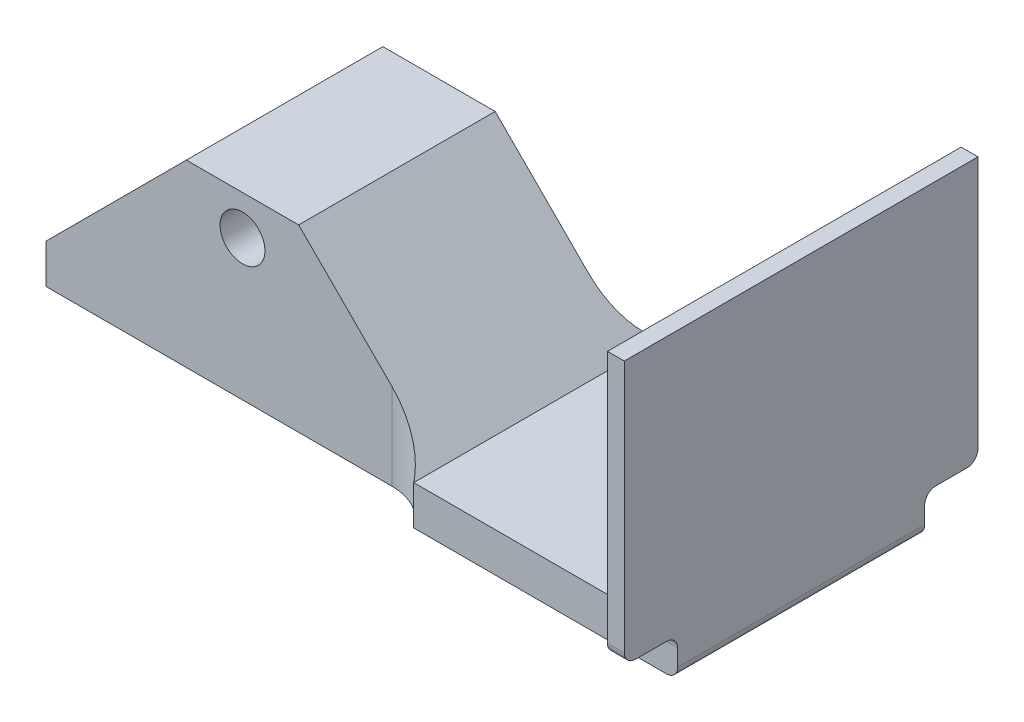
from build123d import *

# Parameters (mm, degrees)
SKETCH1_W           = 70
SKETCH1_H           = 35
BOSS_EXTRUDE1_DEPTH = 32
SKETCH2_R           = 4
CUT_EXTRUDE1_DEPTH  = 59.940648113
CHAMFER1_SIZE       = 25
SKETCH3_W           = 44
SKETCH3_H           = 7
BOSS_EXTRUDE2_DEPTH = 47
FILLET1_R           = 10
FILLET2_R           = 10
SKETCH4_W           = 3
SKETCH4_H           = 63
BOSS_EXTRUDE3_DEPTH = 47
FILLET3_R           = 2


with BuildPart() as part:
    # Sketch1 → Boss-Extrude1 (new body)
    with BuildSketch(Plane(origin=(0, 0, 0), x_dir=(1, 0, 0), z_dir=(0, 1, 0))):
        Rectangle(SKETCH1_W, SKETCH1_H)
    extrude(amount=BOSS_EXTRUDE1_DEPTH)

    # Sketch2 → Cut-Extrude1 (cut, through all)
    with BuildSketch(Plane.XY.offset(17.5)):
        with Locations((0, 25)):
            Circle(SKETCH2_R)
    extrude(amount=-CUT_EXTRUDE1_DEPTH, mode=Mode.SUBTRACT)

    # Chamfer1
    chamfer1_edges = [part.edges().sort_by_distance(p)[0] for p in [
        (-35, 32, 0),
        (35, 32, 0),
    ]]
    chamfer(chamfer1_edges, length=CHAMFER1_SIZE)

    # Sketch3 → Boss-Extrude2 (add)
    with BuildSketch(Plane(origin=(35, 0, 0), x_dir=(0, 0, -1), z_dir=(1, 0, 0))):
        with Locations((0, 3.5)):
            Rectangle(SKETCH3_W, SKETCH3_H)
    extrude(amount=BOSS_EXTRUDE2_DEPTH)

    # Fillet1
    # the kernel refuses this fillet: 10 mm, written as the material it adds along each edge
    with BuildSketch(Plane(origin=(35, 0, -17.5), x_dir=(-1.5347723092402642e-12, 0, -1.0), z_dir=(0, 1, 0))) as fillet1_piece_1_section:
        with BuildLine():
            CenterArc((10, 8.351646544), FILLET1_R, 180, 56.632987031)
            Line((0, 8.351646544), (-0.2, 8.351646544))
            Line((-0.2, 8.351646544), (-0.2, 0))
            Line((-0.2, 0), (0, -0.2))
            ThreePointArc((0, -0.2), (2.25, -0.2), (4.39, -0.167032931))
            Line((4.39, -0.167032931), (4.5, 0))
        make_face()
    fillet1_piece_1 = extrude(amount=7, mode=Mode.PRIVATE)
    fillet1_piece_1 = split(fillet1_piece_1, bisect_by=Plane(origin=(35.692594852, 6.307405148, -18.660307251), z_dir=(-0.7071067811865476, -0.7071067811865476, 0)), keep=Keep.TOP, mode=Mode.PRIVATE)
    add(fillet1_piece_1)
    with BuildSketch(Plane(origin=(35, 0, -17.5), x_dir=(-1.5347723092402642e-12, 0, -1.0), z_dir=(0, 1, 0))) as fillet1_piece_2_section:
        with BuildLine():
            CenterArc((10, 8.351646544), FILLET1_R, 180, 56.632987031)
            Line((0, 8.351646544), (-0.2, 8.351646544))
            Line((-0.2, 8.351646544), (-0.2, 0))
            Line((-0.2, 0), (0, -0.2))
            ThreePointArc((0, -0.2), (2.25, -0.2), (4.39, -0.167032931))
            Line((4.39, -0.167032931), (4.5, 0))
        make_face()
    fillet1_piece_2 = extrude(amount=27.879116361, mode=Mode.PRIVATE)
    fillet1_piece_2 = split(fillet1_piece_2, bisect_by=Plane(origin=(31.191797934, 7, -18.092333784), z_dir=(0, 1, 0)), keep=Keep.TOP, mode=Mode.PRIVATE)
    fillet1_piece_2 = split(fillet1_piece_2, bisect_by=Plane(origin=(32.143848451, 9.856151549, -18.092333784), z_dir=(-0.7071067811865476, -0.7071067811865476, 0)), keep=Keep.TOP, mode=Mode.PRIVATE)
    add(fillet1_piece_2)
    with BuildSketch(Plane(origin=(35, 0, -17.5), x_dir=(-1.5347723092402642e-12, 0, -1.0), z_dir=(0, 1, 0))) as fillet1_piece_3_section:
        with BuildLine():
            CenterArc((10, 8.351646544), FILLET1_R, 180, 56.632987031)
            Line((0, 8.351646544), (-0.2, 8.351646544))
            Line((-0.2, 8.351646544), (-0.2, 0))
            Line((-0.2, 0), (0, -0.2))
            ThreePointArc((0, -0.2), (2.25, -0.2), (4.39, -0.167032931))
            Line((4.39, -0.167032931), (4.5, 0))
        make_face()
    fillet1_piece_3 = extrude(amount=7, mode=Mode.PRIVATE)
    fillet1_piece_3 = split(fillet1_piece_3, bisect_by=Plane(origin=(35.097400014, 6.902599986, -19.555271065), z_dir=(0.7071067811865476, 0.7071067811865476, 0)), keep=Keep.TOP, mode=Mode.PRIVATE)
    add(fillet1_piece_3)

    # Fillet2
    # the kernel refuses this fillet: 10 mm, written as the material it adds along each edge
    with BuildSketch(Plane(origin=(35, 0, 17.5), x_dir=(-1.5331933253830236e-12, 0, 1.0), z_dir=(0, 1, 0))) as fillet2_piece_1_section:
        with BuildLine():
            CenterArc((10, -8.351646544), FILLET2_R, 123.367012969, 56.632987031)
            Line((0, -8.351646544), (-0.2, -8.351646544))
            Line((-0.2, -8.351646544), (-0.2, 0))
            Line((-0.2, 0), (0, 0.2))
            ThreePointArc((0, 0.2), (2.25, 0.2), (4.39, 0.167032931))
            Line((4.39, 0.167032931), (4.5, 0))
        make_face()
    fillet2_piece_1 = extrude(amount=7, mode=Mode.PRIVATE)
    fillet2_piece_1 = split(fillet2_piece_1, bisect_by=Plane(origin=(35.692594852, 6.307405148, 18.660307251), z_dir=(-0.7071067811865476, -0.7071067811865476, 0)), keep=Keep.TOP, mode=Mode.PRIVATE)
    add(fillet2_piece_1)
    with BuildSketch(Plane(origin=(35, 0, 17.5), x_dir=(-1.5331933253830236e-12, 0, 1.0), z_dir=(0, 1, 0))) as fillet2_piece_2_section:
        with BuildLine():
            CenterArc((10, -8.351646544), FILLET2_R, 123.367012969, 56.632987031)
            Line((0, -8.351646544), (-0.2, -8.351646544))
            Line((-0.2, -8.351646544), (-0.2, 0))
            Line((-0.2, 0), (0, 0.2))
            ThreePointArc((0, 0.2), (2.25, 0.2), (4.39, 0.167032931))
            Line((4.39, 0.167032931), (4.5, 0))
        make_face()
    fillet2_piece_2 = extrude(amount=27.879116361, mode=Mode.PRIVATE)
    fillet2_piece_2 = split(fillet2_piece_2, bisect_by=Plane(origin=(31.191797934, 7, 18.092333784), z_dir=(0, 1, 0)), keep=Keep.TOP, mode=Mode.PRIVATE)
    fillet2_piece_2 = split(fillet2_piece_2, bisect_by=Plane(origin=(32.143848451, 9.856151549, 18.092333784), z_dir=(-0.7071067811865476, -0.7071067811865476, 0)), keep=Keep.TOP, mode=Mode.PRIVATE)
    add(fillet2_piece_2)
    with BuildSketch(Plane(origin=(35, 0, 17.5), x_dir=(-1.5331933253830236e-12, 0, 1.0), z_dir=(0, 1, 0))) as fillet2_piece_3_section:
        with BuildLine():
            CenterArc((10, -8.351646544), FILLET2_R, 123.367012969, 56.632987031)
            Line((0, -8.351646544), (-0.2, -8.351646544))
            Line((-0.2, -8.351646544), (-0.2, 0))
            Line((-0.2, 0), (0, 0.2))
            ThreePointArc((0, 0.2), (2.25, 0.2), (4.39, 0.167032931))
            Line((4.39, 0.167032931), (4.5, 0))
        make_face()
    fillet2_piece_3 = extrude(amount=7, mode=Mode.PRIVATE)
    fillet2_piece_3 = split(fillet2_piece_3, bisect_by=Plane(origin=(35.097400014, 6.902599986, 19.555271065), z_dir=(0.7071067811865476, 0.7071067811865476, 0)), keep=Keep.TOP, mode=Mode.PRIVATE)
    add(fillet2_piece_3)

    # Sketch4 → Boss-Extrude3 (add)
    with BuildSketch(Plane(origin=(0, 7, 0), x_dir=(1, 0, 0), z_dir=(0, 1, 0))):
        with Locations((80.5, 0)):
            Rectangle(SKETCH4_W, SKETCH4_H)
    extrude(amount=BOSS_EXTRUDE3_DEPTH)

    # Fillet3
    fillet3_edges = [part.edges().sort_by_distance(p)[0] for p in [
        (80.5, 7, 22),
        (80.5, 7, -22),
        (82, 0, 0),
        (80.5, 7, -31.5),
        (80.5, 7, 31.5),
    ]]
    fillet(fillet3_edges, radius=FILLET3_R)


solid = part.part
